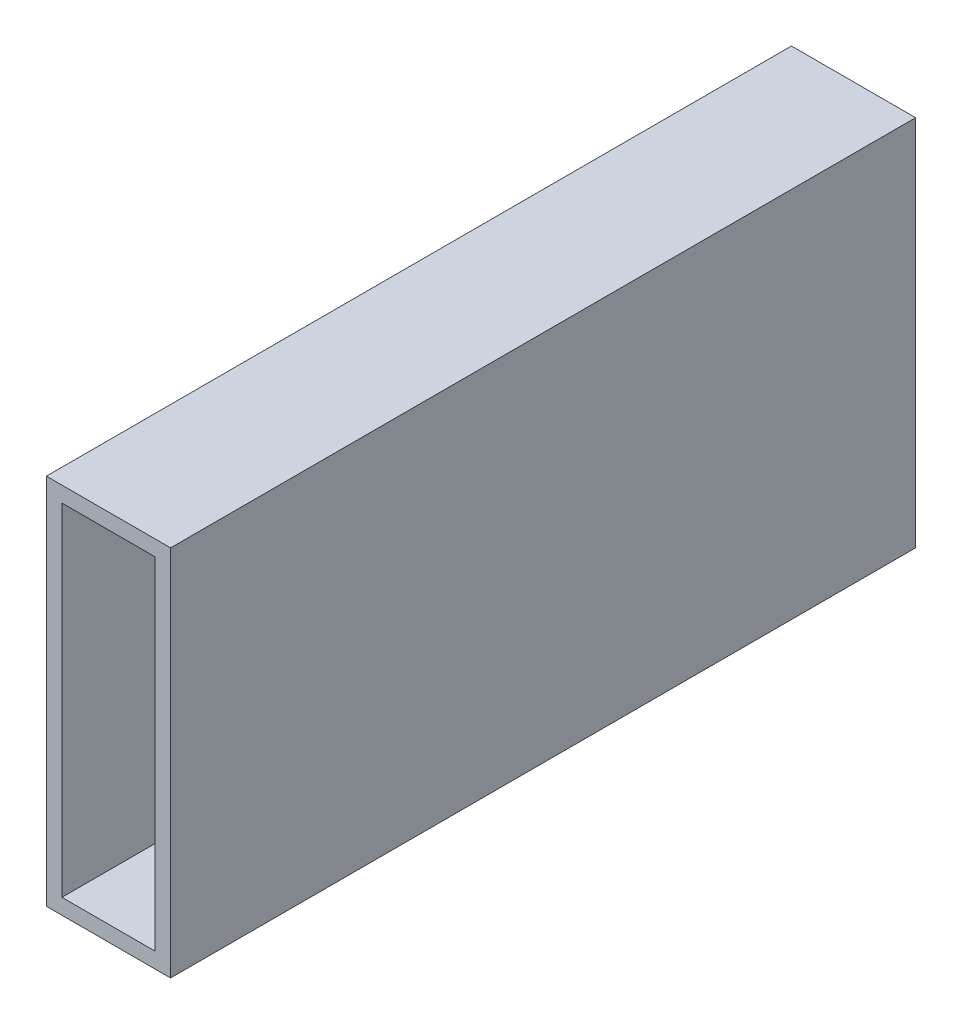
from build123d import *

# Parameters (mm, degrees)
SKETCH1_W           = 25.4
SKETCH1_H           = 76.2
BOSS_EXTRUDE1_DEPTH = 76.2
SHELL1_T            = -3.175


with BuildPart() as part:
    # Sketch1 → Boss-Extrude1 (new, symmetric)
    with BuildSketch(Plane.XY):
        Rectangle(SKETCH1_W, SKETCH1_H)
    extrude(amount=BOSS_EXTRUDE1_DEPTH, both=True)

    # Shell1
    shell1_openings = [part.faces().sort_by_distance(p)[0] for p in [
        (0, 0, -76.2),
        (0, 0, 76.2),
    ]]
    offset(amount=SHELL1_T, openings=shell1_openings, kind=Kind.INTERSECTION)


solid = part.part
